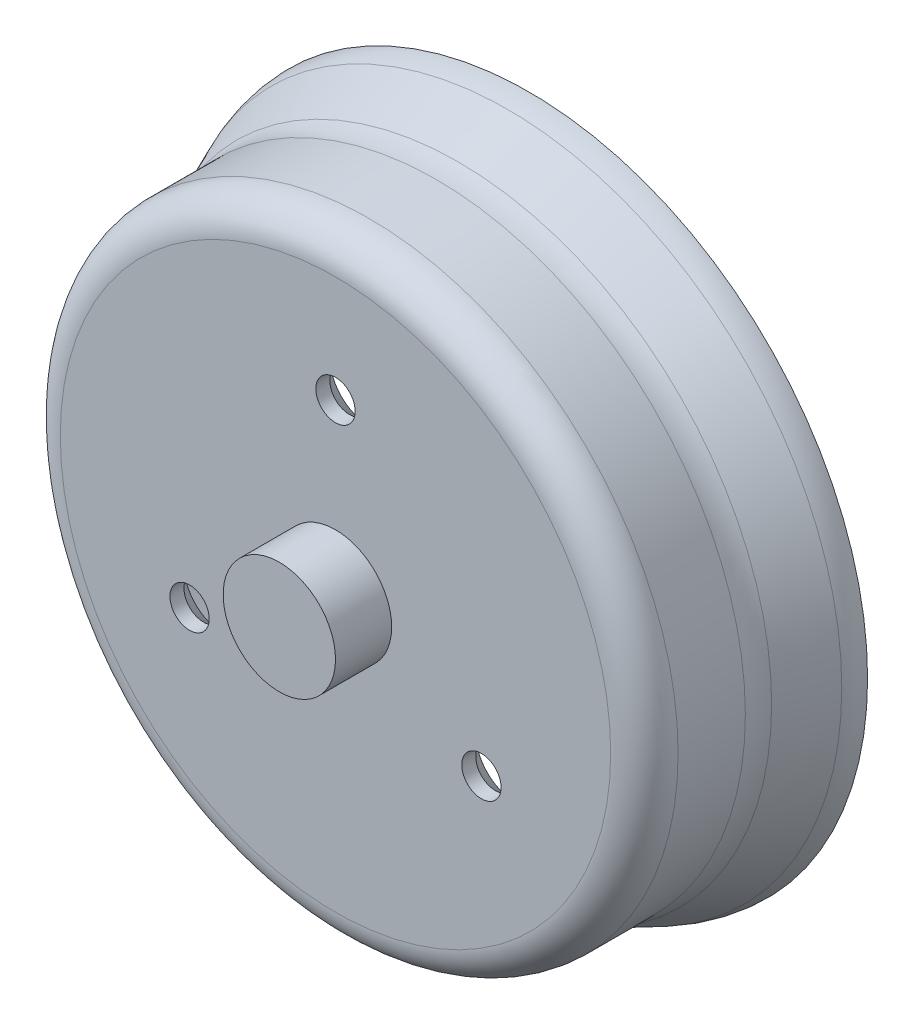
from build123d import *

# Parameters (mm, degrees)
SKETCH_1_R          = 27.5
SKETCH_1_R_2        = 25.5
EXTRUDE_1_DEPTH     = 10
EXTRUDE_START       = -3
SKETCH_2_R          = 27.5
EXTRUDE_2_DEPTH     = 3
FILLET_1_R          = 3
SKETCH_3_R          = 5
EXTRUDE_3_DEPTH     = 5
SKETCH_4_R          = 1.75
CUT_EXTRUDE_1_DEPTH = 10
CHAMFER_1_SIZE      = 1.75
FILLET_2_R          = 5
CHAMFER_2_SIZE      = 2
CHAMFER_2_SIZE_2    = 3.756603815
FILLET_3_R          = 5


with BuildPart() as part:
    # 草图1 → 凸台-拉伸1 (new body)
    with BuildSketch(Plane.XY):
        Circle(SKETCH_1_R)
        Circle(SKETCH_1_R_2, mode=Mode.SUBTRACT)
    extrude(amount=EXTRUDE_1_DEPTH)

    # 草图2 → 凸台-拉伸2 (add)
    with BuildSketch(Plane.XY.offset(10).offset(EXTRUDE_START)):
        Circle(SKETCH_2_R)
    extrude(amount=EXTRUDE_2_DEPTH)

    # 圆角1
    fillet_1_edges = [part.edges().sort_by_distance(p)[0] for p in [
        (-27.5, 0, 10),
    ]]
    fillet(fillet_1_edges, radius=FILLET_1_R)

    # 草图3 → 凸台-拉伸3 (add)
    with BuildSketch(Plane.XY.offset(10)):
        Circle(SKETCH_3_R)
    extrude(amount=EXTRUDE_3_DEPTH)

    # 草图4 → 切除-拉伸1 (cut)
    with BuildSketch(Plane.XY.offset(10)):
        with Locations((0, 15)):
            Circle(SKETCH_4_R)
        with Locations((12.990381057, -7.5)):
            Circle(SKETCH_4_R)
        with Locations((-12.990381057, -7.5)):
            Circle(SKETCH_4_R)
    extrude(amount=-CUT_EXTRUDE_1_DEPTH, mode=Mode.SUBTRACT)

    # 倒角1
    chamfer_1_edges = [part.edges().sort_by_distance(p)[0] for p in [
        (-1.75, 15, 7),
        (11.240381057, -7.5, 7),
        (-14.740381057, -7.5, 7),
    ]]
    chamfer(chamfer_1_edges, length=CHAMFER_1_SIZE)

    # 草图5 → 旋转1 (revolve)
    with BuildSketch(Plane(origin=(0, 0, 0), x_dir=(1, 0, 0), z_dir=(0, 1, 0))):
        Polygon((27.5, 0), (31, 8.291561976), (29, 8.291561976), (25.5, 0), align=None)
    revolve(axis=Axis((0, 0, 15), (0, 0, -1)))

    # 圆角2
    fillet_2_edges = [part.edges().sort_by_distance(p)[0] for p in [
        (-25.5, 0, 0),
    ]]
    fillet(fillet_2_edges, radius=FILLET_2_R)

    # 倒角2
    # the kernel refuses this chamfer: 3.756603815, 2 mm, written as the material it takes off along each edge
    with BuildSketch(Plane(origin=(0, 0, -8.291561976), x_dir=(1, 0, 0), z_dir=(0, 1, 0))) as chamfer_2_piece_1:
        Polygon((29 - CHAMFER_2_SIZE * 0.388888888889, -CHAMFER_2_SIZE * 0.921284663988), (29 + CHAMFER_2_SIZE_2, 0), (29, 0), align=None)
    revolve(axis=Axis((0, 0, -8.291561976), (0, 0, -1)), mode=Mode.SUBTRACT)

    # 圆角3
    fillet_3_edges = [part.edges().sort_by_distance(p)[0] for p in [
        (-28.222222222, 0, -6.448992648),
    ]]
    fillet(fillet_3_edges, radius=FILLET_3_R)

    # 圆角4: read off the stored shape, not the designer's step
    # 圆角4 outline → 圆角4 (revolve, cut)
    with BuildSketch(Plane.XZ):
        with BuildLine():
            Line((30.636307825, -5.324394926), (29.747511663, -5.324394926))
            ThreePointArc((29.747511663, -5.324394926), (30.037682192, -6.257222508), (30.140926968, -7.228668209))
            Line((30.140926968, -7.228668209), (30.636307825, -7.429968773))
            Line((30.636307825, -7.429968773), (30.636307825, -5.324394926))
        make_face()
    revolve(axis=Axis((0, 0, 0), (0, 0, 1)), mode=Mode.SUBTRACT)

    # Fillet 4 2 outline → Fillet 4 2 (revolve)
    with BuildSketch(Plane.XZ):
        with BuildLine():
            Line((27.5, -0.932390124), (27.89357668, -0.932390124))
            ThreePointArc((27.89357668, -0.932390124), (27.599381845, 0.020115965), (27.5, 1.01205432))
            Line((27.5, 1.01205432), (27.5, -0.932390124))
        make_face()
    revolve(axis=Axis((0, 0, 0), (0, 0, 1)))


solid = part.part
